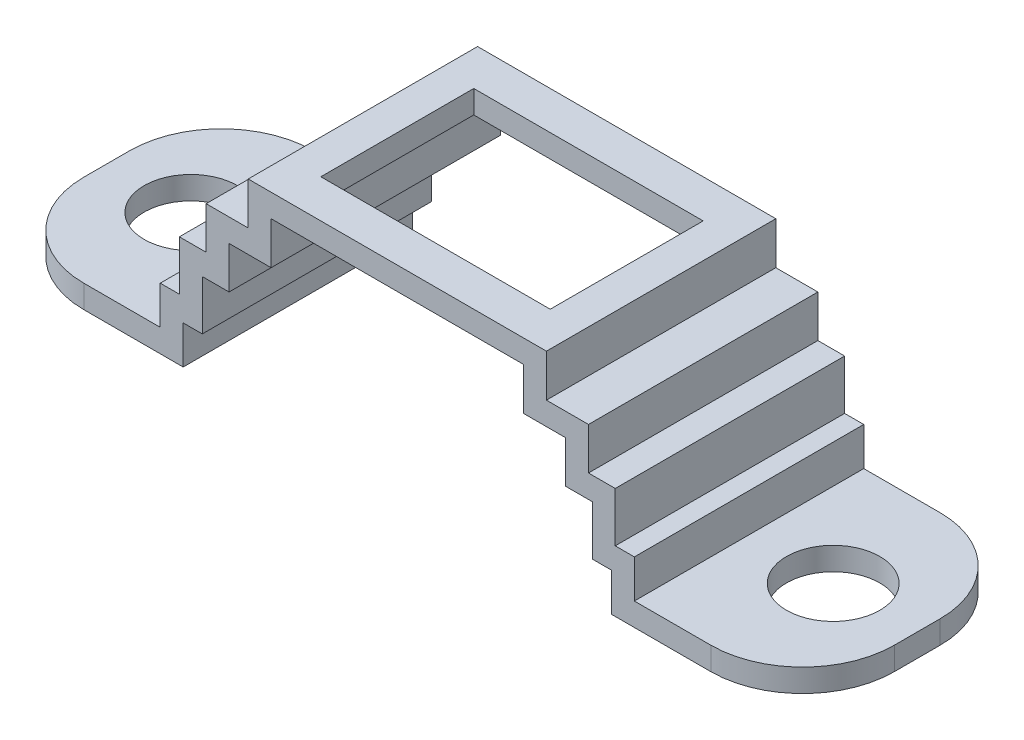
from build123d import *

# Parameters (mm, degrees)
EXTRUDE_THIN1_DEPTH  = 15
SKETCH2_R            = 6.1
CUT_EXTRUDE1_DEPTH   = 60.518925562
FILLET1_R            = 12
FILLET1_OF_MIRROR1_R = 12
SKETCH3_W            = 30
SKETCH3_H            = 20
CUT_EXTRUDE2_DEPTH   = 61.719045612


with BuildPart() as part:
    # Sketch1 → Extrude-Thin1 (new, symmetric)
    with BuildSketch(Plane.XY):
        Polygon((-53, 4.5), (-28, 4.5), (-28, 9.5), (-25.5, 9.5), (-25.5, 16), (-22, 16), (-22, 21.5), (-16.5, 21.5), (-16.5, 27.05), (0, 27.05), (0, 30.05), (-19.5, 30.05), (-19.5, 24.5), (-25, 24.5), (-25, 19), (-28.5, 19), (-28.5, 12.5), (-31, 12.5), (-31, 7.5), (-53, 7.5), align=None)
    extrude_thin1 = extrude(amount=EXTRUDE_THIN1_DEPTH, both=True)

    # Sketch2 → Cut-Extrude1 (cut, through all)
    with BuildSketch(Plane(origin=(0, 7.5, 0), x_dir=(1, 0, 0), z_dir=(0, 1, 0))):
        with Locations((-42, 0)):
            Circle(SKETCH2_R)
    cut_extrude1 = extrude(amount=-CUT_EXTRUDE1_DEPTH, mode=Mode.SUBTRACT)

    # Fillet1
    fillet1_edges = [part.edges().sort_by_distance(p)[0] for p in [
        (-53, 6, -15),
        (-53, 6, 15),
    ]]
    fillet(fillet1_edges, radius=FILLET1_R)

    # Mirror1: Extrude-Thin1, Cut-Extrude1 across plane
    add(extrude_thin1.mirror(Plane(origin=(0, 30.05, 15), x_dir=(0, 0, 1), z_dir=(1, 0, 0))))
    add(cut_extrude1.mirror(Plane(origin=(0, 30.05, 15), x_dir=(0, 0, 1), z_dir=(1, 0, 0))), mode=Mode.SUBTRACT)

    # Fillet1 of Mirror1
    fillet1_of_mirror1_edges = [part.edges().sort_by_distance(p)[0] for p in [
        (53, 6, -15),
        (53, 6, 15),
    ]]
    fillet(fillet1_of_mirror1_edges, radius=FILLET1_OF_MIRROR1_R)

    # Sketch3 → Cut-Extrude2 (cut, through all)
    with BuildSketch(Plane(origin=(0, 30.05, 0), x_dir=(1, 0, 0), z_dir=(0, 1, 0))):
        Rectangle(SKETCH3_W, SKETCH3_H)
    extrude(amount=-CUT_EXTRUDE2_DEPTH, mode=Mode.SUBTRACT)


solid = part.part
